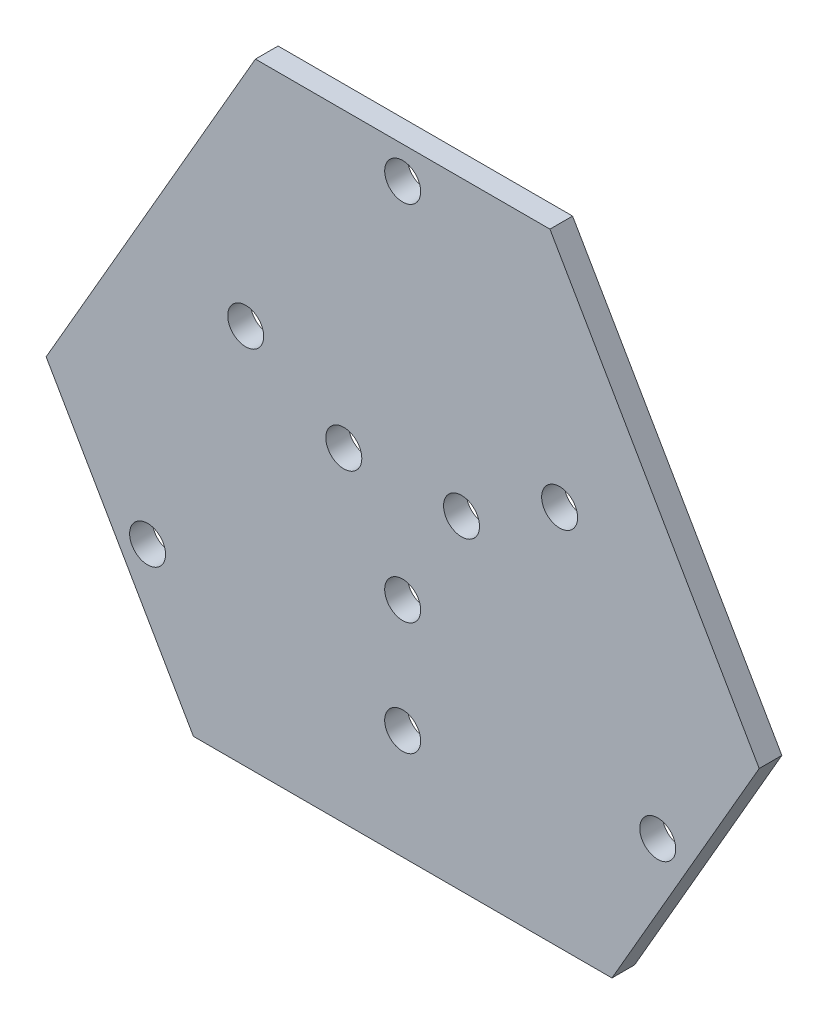
from build123d import *

# Parameters (mm, degrees)
BOSS_EXTRUDE1_DEPTH     = 6.35
F_3_8_CLEARANCE_HOLE1_D = 10.0838
F_3_8_CLEARANCE_HOLE2_D = 10.0838
CIRPATTERN1_COUNT       = 3


with BuildPart() as part:
    # Sketch1 → Boss-Extrude1 (new body)
    with BuildSketch(Plane.XY):
        Polygon((-41.275, 91.563465694), (41.275, 91.563465694), (99.93378735, -10.036534306), (58.65878735, -81.526931388), (-58.65878735, -81.526931388), (-99.93378735, -10.036534306), align=None)
    extrude(amount=BOSS_EXTRUDE1_DEPTH)

    # 3/8 Clearance Hole1 (through all)
    with Locations(Plane.XY.offset(6.35)):
        with Locations((0, 82.55)):
            f_3_8_clearance_hole1 = Hole(F_3_8_CLEARANCE_HOLE1_D / 2)

    # 3/8 Clearance Hole2 (through all)
    with Locations(Plane.XY.offset(6.35)):
        with Locations((43.994090512, 25.4), (16.497783942, 9.525)):
            f_3_8_clearance_hole2 = Hole(F_3_8_CLEARANCE_HOLE2_D / 2)

    # CirPattern1: 3/8 Clearance Hole1, 3/8 Clearance Hole2 ×3 about axis
    cirpattern1_axis = Axis((0, 0, 0), (0, 0, 1))
    add([f_3_8_clearance_hole1.rotate(cirpattern1_axis, i * 360 / CIRPATTERN1_COUNT) for i in range(1, CIRPATTERN1_COUNT)], mode=Mode.SUBTRACT)
    add([f_3_8_clearance_hole2.rotate(cirpattern1_axis, i * 360 / CIRPATTERN1_COUNT) for i in range(1, CIRPATTERN1_COUNT)], mode=Mode.SUBTRACT)


solid = part.part
